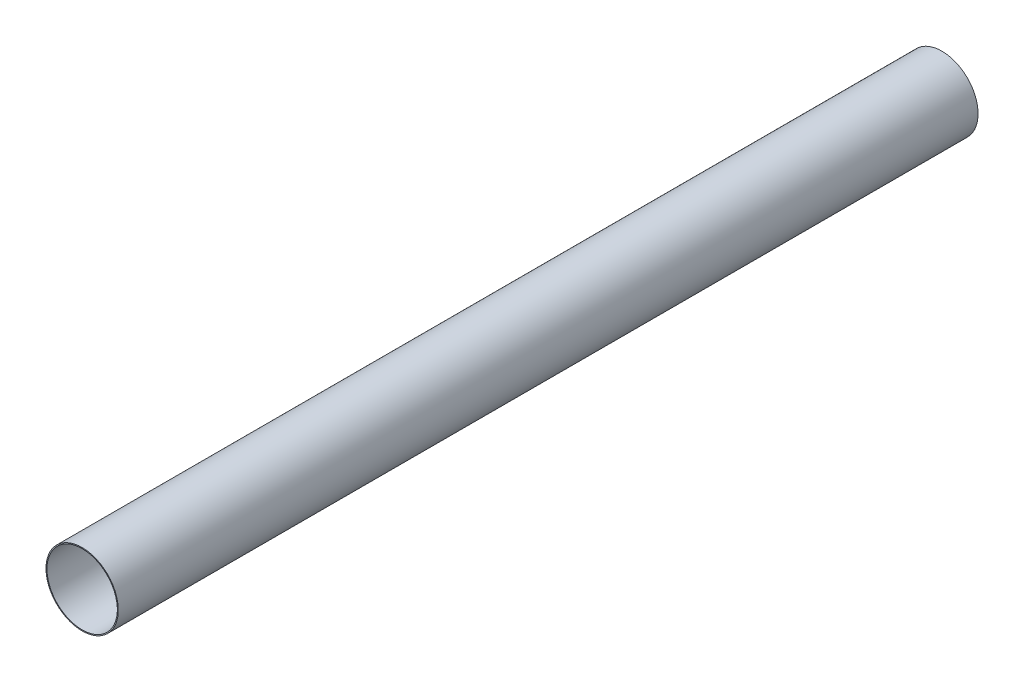
from build123d import *

# Parameters (mm, degrees)
SKETCH1_R           = 75
SKETCH1_R_2         = 73
BOSS_EXTRUDE1_DEPTH = 1784


with BuildPart() as part:
    # Sketch1 → Boss-Extrude1 (new body)
    with BuildSketch(Plane.XY):
        Circle(SKETCH1_R)
        Circle(SKETCH1_R_2, mode=Mode.SUBTRACT)
    extrude(amount=BOSS_EXTRUDE1_DEPTH)


solid = part.part
